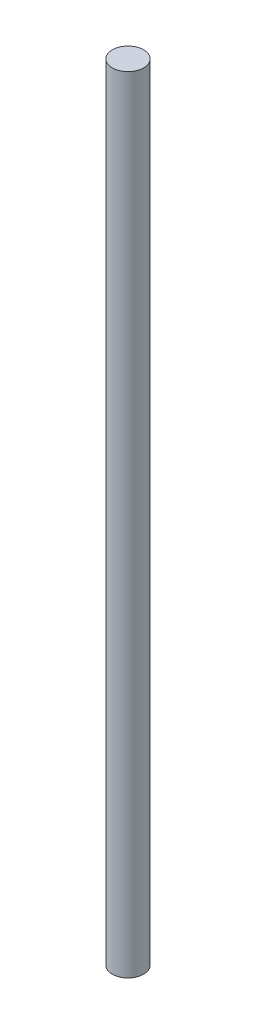
from build123d import *

# Parameters (mm, degrees)
SKETCH2_R           = 2
BOSS_EXTRUDE1_DEPTH = 100


with BuildPart() as part:
    # Sketch2 → Boss-Extrude1 (new body)
    with BuildSketch(Plane(origin=(0, 0, 0), x_dir=(1, 0, 0), z_dir=(0, 1, 0))):
        Circle(SKETCH2_R)
    extrude(amount=BOSS_EXTRUDE1_DEPTH)


solid = part.part
